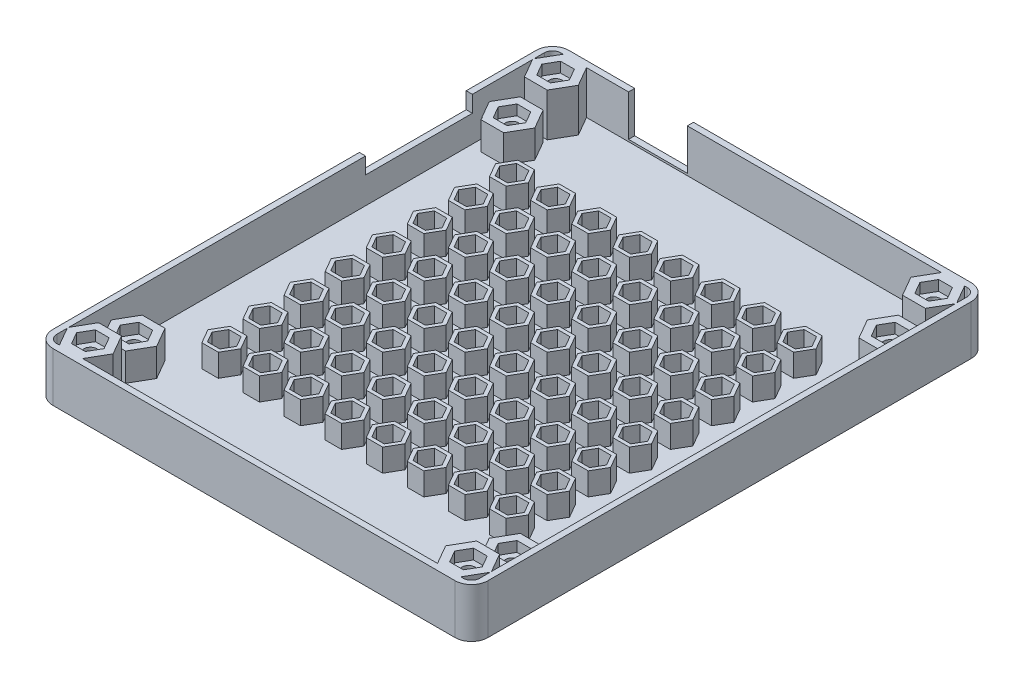
from build123d import *

# Parameters (mm, degrees)
P_IDAT_VYSUNUT_M25_DEPTH      = 3
P_IDAT_VYSUNUT_M26_DEPTH      = 10.5
P_IDAT_VYSUNUT_M26_DEPTH_BACK = 3
SKICA1_21_W                   = 105.885125168
SKICA1_21_H                   = 125.6
SKICA1_21_W_2                 = 102.885125168
SKICA1_21_H_2                 = 122.6
P_IDAT_VYSUNUT_M28_DEPTH      = 6.8
SKICA1_24_R                   = 1.6
P_IDAT_VYSUNUT_M29_DEPTH      = 4.3
LINPOLE3_COUNT                = 2
LINPOLE3_PITCH                = 92
LINPOLE3_COUNT_DIR2           = 2
LINPOLE3_PITCH_DIR2           = 92
P_IDAT_VYSUNUT_M30_DEPTH      = 10.5
SKICA1_26_R                   = 1.6
P_IDAT_VYSUNUT_M31_DEPTH      = 8
LINPOLE4_COUNT                = 2
LINPOLE4_PITCH                = 92
LINPOLE4_COUNT_DIR2           = 2
LINPOLE4_PITCH_DIR2           = 113.2
ZAOBLIT4_R                    = 4
SKICA9_W                      = 26
SKICA9_H                      = 4
ODEBRAT_VYSUNUT_M1_DEPTH      = 4
SKICA10_W                     = 14.3
SKICA10_H                     = 10
ODEBRAT_VYSUNUT_M2_DEPTH      = 5
P_IDAT_VYSUNUT_M32_DEPTH      = 5.5
LINPOLE5_COUNT                = 8
LINPOLE5_PITCH                = 10
LINPOLE5_COUNT_DIR2           = 8
LINPOLE5_PITCH_DIR2           = 10
SKICA12_W                     = 134.755212012
SKICA12_H                     = 11.049060792
ODEBRAT_VYSUNUT_M3_DEPTH      = 124.554642697
ZAOBLIT5_R                    = 2


with BuildPart() as part:
    # Skica1 → Přidat vysunutím25 (new body)
    with BuildSketch(Plane(origin=(0, 0, 0), x_dir=(1, 0, 0), z_dir=(0, 1, 0))):
        Polygon((51.442562584, 61.3), (-43.170983681, 61.3), (-43.228718708, 61.4), (-48.771281292, 61.4), (-48.829016319, 61.3), (-51.442562584, 61.3), (-51.442562584, 56.773205081), (-51.542562584, 56.6), (-51.442562584, 56.426794919), (-51.442562584, 46.173205081), (-51.542562584, 46), (-51.442562584, 45.826794919), (-51.442562584, -61.3), (51.442562584, -61.3), align=None)
    extrude(amount=-P_IDAT_VYSUNUT_M25_DEPTH)

    # Skica1<21> → Přidat vysunutím26 (add, two sides: drawn at the far end of the back side and taken through both)
    with BuildSketch(Plane(origin=(0, 0, 0), x_dir=(1, 0, 0), z_dir=(0, 1, 0)).offset(-P_IDAT_VYSUNUT_M26_DEPTH_BACK)):
        Rectangle(SKICA1_21_W, SKICA1_21_H)
        Rectangle(SKICA1_21_W_2, SKICA1_21_H_2, mode=Mode.SUBTRACT)
    extrude(amount=P_IDAT_VYSUNUT_M26_DEPTH + P_IDAT_VYSUNUT_M26_DEPTH_BACK)

    # Skica1<23> → Přidat vysunutím28 (add)
    with BuildSketch(Plane(origin=(0, 0, 0), x_dir=(1, 0, 0), z_dir=(0, 1, 0))):
        Polygon((-48.771281292, 41.2), (-43.228718708, 41.2), (-40.457437416, 46), (-43.228718708, 50.8), (-48.771281292, 50.8), (-51.542562584, 46), align=None)
        Polygon((-44.325684219, 43.1), (-47.674315781, 43.1), (-49.348631561, 46), (-47.674315781, 48.9), (-44.325684219, 48.9), (-42.651368439, 46), align=None, mode=Mode.SUBTRACT)
    p_idat_vysunut_m28 = extrude(amount=P_IDAT_VYSUNUT_M28_DEPTH)

    # Skica1<24> → Přidat vysunutím29 (add)
    with BuildSketch(Plane(origin=(0, 0, 0), x_dir=(1, 0, 0), z_dir=(0, 1, 0))):
        Polygon((-49.348631561, 46), (-47.674315781, 43.1), (-44.325684219, 43.1), (-42.651368439, 46), (-44.325684219, 48.9), (-47.674315781, 48.9), align=None)
        with Locations((-46, 46)):
            Circle(SKICA1_24_R, mode=Mode.SUBTRACT)
    p_idat_vysunut_m29 = extrude(amount=P_IDAT_VYSUNUT_M29_DEPTH)

    # LinPole3: Přidat vysunutím28, P_idat vysunut_m29 2 × 2
    with Locations(*[(i * LINPOLE3_PITCH, 0, j * LINPOLE3_PITCH_DIR2) for i in range(LINPOLE3_COUNT) for j in range(LINPOLE3_COUNT_DIR2) if (i, j) != (0, 0)]):
        add(p_idat_vysunut_m28)
        add(p_idat_vysunut_m29)

    # Skica1<25> → Přidat vysunutím30 (add)
    with BuildSketch(Plane(origin=(0, 0, 0), x_dir=(1, 0, 0), z_dir=(0, 1, 0))):
        Polygon((-51.542562584, 56.6), (-48.771281292, 51.8), (-43.228718708, 51.8), (-40.457437416, 56.6), (-43.228718708, 61.4), (-48.771281292, 61.4), align=None)
        Polygon((-44.325684219, 59.5), (-42.651368439, 56.6), (-44.325684219, 53.7), (-47.674315781, 53.7), (-49.348631561, 56.6), (-47.674315781, 59.5), align=None, mode=Mode.SUBTRACT)
    p_idat_vysunut_m30 = extrude(amount=P_IDAT_VYSUNUT_M30_DEPTH)

    # Skica1<26> → Přidat vysunutím31 (add)
    with BuildSketch(Plane(origin=(0, 0, 0), x_dir=(1, 0, 0), z_dir=(0, 1, 0))):
        Polygon((-44.325684219, 53.7), (-42.651368439, 56.6), (-44.325684219, 59.5), (-47.674315781, 59.5), (-49.348631561, 56.6), (-47.674315781, 53.7), align=None)
        with Locations((-46, 56.6)):
            Circle(SKICA1_26_R, mode=Mode.SUBTRACT)
    p_idat_vysunut_m31 = extrude(amount=P_IDAT_VYSUNUT_M31_DEPTH)

    # LinPole4: Přidat vysunutím30, P_idat vysunut_m31 2 × 2
    with Locations(*[(i * LINPOLE4_PITCH, 0, j * LINPOLE4_PITCH_DIR2) for i in range(LINPOLE4_COUNT) for j in range(LINPOLE4_COUNT_DIR2) if (i, j) != (0, 0)]):
        add(p_idat_vysunut_m30)
        add(p_idat_vysunut_m31)

    # Zaoblit4
    zaoblit4_edges = [part.edges().sort_by_distance(p)[0] for p in [
        (-52.942562584, 3.75, 62.8),
        (52.942562584, 3.75, 62.8),
        (52.942562584, 3.75, -62.8),
        (-52.942562584, 3.75, -62.8),
    ]]
    fillet(zaoblit4_edges, radius=ZAOBLIT4_R)

    # Skica9 → Odebrat vysunutím1 (cut)
    with BuildSketch(Plane.ZY.offset(52.942562584)):
        with Locations((-28.8, 8.5)):
            Rectangle(SKICA9_W, SKICA9_H)
    extrude(amount=-ODEBRAT_VYSUNUT_M1_DEPTH, mode=Mode.SUBTRACT)

    # Skica10 → Odebrat vysunutím2 (cut)
    with BuildSketch(Plane(origin=(0, 0, -62.8), x_dir=(-1, 0, 0), z_dir=(0, 0, -1))):
        with Locations((25.792562584, 5.5)):
            Rectangle(SKICA10_W, SKICA10_H)
    extrude(amount=-ODEBRAT_VYSUNUT_M2_DEPTH, mode=Mode.SUBTRACT)

    # Skica11 → Přidat vysunutím32 (add)
    with BuildSketch(Plane(origin=(0, 0, 0), x_dir=(1, 0, 0), z_dir=(0, 1, 0))):
        Polygon((-33, 31.535898385), (-31, 35), (-33, 38.464101615), (-37, 38.464101615), (-39, 35), (-37, 31.535898385), align=None)
        Polygon((-33.5, 32.401923789), (-32, 35), (-33.5, 37.598076211), (-36.5, 37.598076211), (-38, 35), (-36.5, 32.401923789), align=None, mode=Mode.SUBTRACT)
    p_idat_vysunut_m32 = extrude(amount=P_IDAT_VYSUNUT_M32_DEPTH)

    # LinPole5: P_idat vysunut_m32 8 × 8
    with Locations(*[(i * LINPOLE5_PITCH, 0, j * LINPOLE5_PITCH_DIR2) for i in range(LINPOLE5_COUNT) for j in range(LINPOLE5_COUNT_DIR2) if (i, j) != (0, 0)]):
        add(p_idat_vysunut_m32)

    # Skica12 → Odebrat vysunutím3 (cut, through all)
    with BuildSketch(Plane(origin=(52.942562584, 0, 0), x_dir=(0, 0, -1), z_dir=(1, 0, 0))):
        with Locations((-0.774482054, -7.024530396)):
            Rectangle(SKICA12_W, SKICA12_H)
    extrude(amount=-ODEBRAT_VYSUNUT_M3_DEPTH, mode=Mode.SUBTRACT)

    # Zaoblit5
    zaoblit5_edges = [part.edges().sort_by_distance(p)[0] for p in [
        (-51.442562584, 5.25, 61.3),
        (51.442562584, 5.25, 61.3),
        (51.442562584, 5.25, -61.3),
        (-51.442562584, 5.25, -61.3),
    ]]
    fillet(zaoblit5_edges, radius=ZAOBLIT5_R)


solid = part.part
